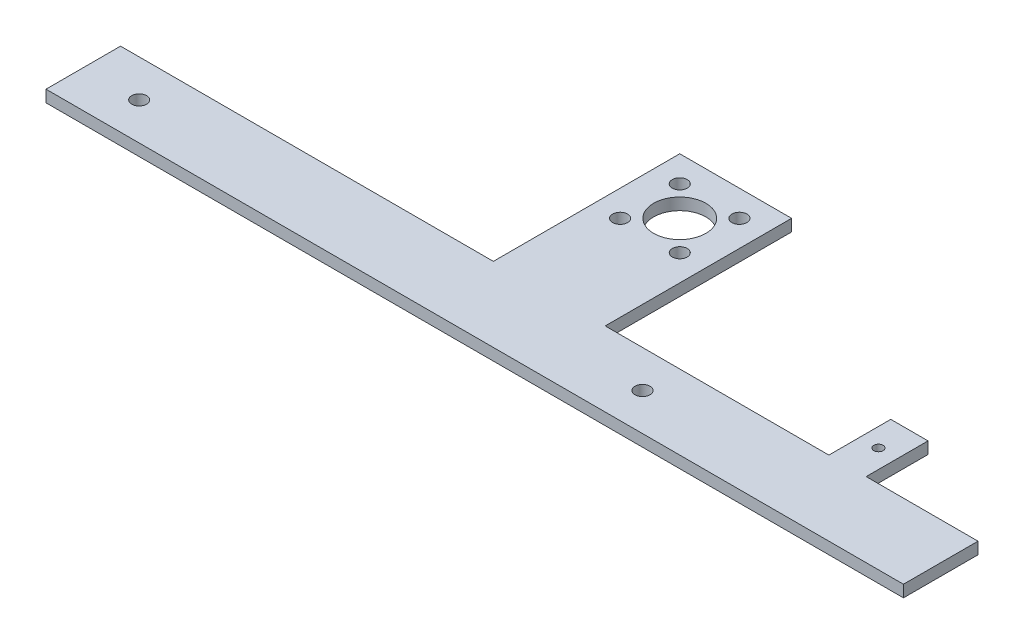
from build123d import *

# Parameters (mm, degrees)
SKETCH1_R           = 2
SKETCH1_R_2         = 1.25
BOSS_EXTRUDE1_DEPTH = 3.175


with BuildPart() as part:
    # Sketch1 → Boss-Extrude1 (new body)
    with BuildSketch(Plane(origin=(0, 0, 0), x_dir=(1, 0, 0), z_dir=(0, 1, 0))):
        Polygon((230, 0), (230, 10), (230, 20), (200, 20), (200, 36.6), (195, 36.6), (190, 36.6), (190, 20), (130, 20), (130, 70), (115, 70), (100, 70), (100, 20), (0, 20), (0, 0), align=None)
        with Locations((15, 10)):
            Circle(SKETCH1_R, mode=Mode.SUBTRACT)
        with BuildLine():
            ThreePointArc((148, 10), (150, 12), (152, 10))
            ThreePointArc((152, 10), (150, 8), (148, 10))
        make_face(mode=Mode.SUBTRACT)
        with Locations((107, 47)):
            Circle(SKETCH1_R, mode=Mode.SUBTRACT)
        with Locations((107, 63)):
            Circle(SKETCH1_R, mode=Mode.SUBTRACT)
        with Locations((123, 47)):
            Circle(SKETCH1_R, mode=Mode.SUBTRACT)
        with BuildLine():
            ThreePointArc((110.050252532, 59.949747468), (112.321215973, 61.467156728), (115, 62))
            ThreePointArc((115, 62), (117.678784027, 48.532843272), (110.050252532, 59.949747468))
        make_face(mode=Mode.SUBTRACT)
        with Locations((123, 63)):
            Circle(SKETCH1_R, mode=Mode.SUBTRACT)
        with Locations((195, 28.3)):
            Circle(SKETCH1_R_2, mode=Mode.SUBTRACT)
    extrude(amount=BOSS_EXTRUDE1_DEPTH)


solid = part.part
